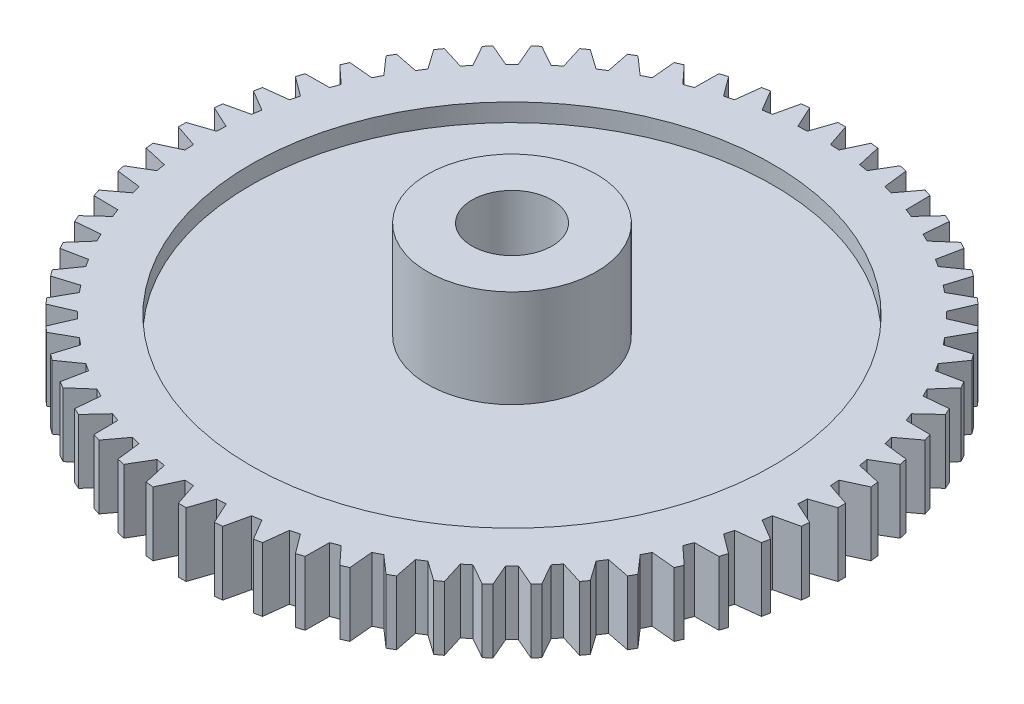
from build123d import *

# Parameters (mm, degrees)
SKETCH1_R           = 30.48
SKETCH1_R_2         = 8.382
BOSS_EXTRUDE1_DEPTH = 6.35
SKETCH1_3_R         = 8.382
SKETCH1_3_R_2       = 3.96875
BOSS_EXTRUDE2_DEPTH = 14.2621
SKETCH1_4_R         = 25.908
SKETCH1_4_R_2       = 8.382
CUT_EXTRUDE1_DEPTH  = 1.778
CUT_EXTRUDE3_START  = 4.572
SKETCH1_8_R         = 25.908
SKETCH1_8_R_2       = 8.382
CUT_EXTRUDE3_DEPTH  = 1.778
BOSS_EXTRUDE3_DEPTH = 6.35
CIRPATTERN1_COUNT   = 60


with BuildPart() as part:
    # Sketch1 → Boss-Extrude1 (new body)
    with BuildSketch(Plane(origin=(0, 0, 0), x_dir=(1, 0, 0), z_dir=(0, 1, 0))):
        Circle(SKETCH1_R)
        Circle(SKETCH1_R_2, mode=Mode.SUBTRACT)
    extrude(amount=BOSS_EXTRUDE1_DEPTH)

    # Sketch1<3> → Boss-Extrude2 (add)
    with BuildSketch(Plane(origin=(0, 0, 0), x_dir=(1, 0, 0), z_dir=(0, 1, 0))):
        Circle(SKETCH1_3_R)
        Circle(SKETCH1_3_R_2, mode=Mode.SUBTRACT)
    extrude(amount=BOSS_EXTRUDE2_DEPTH)

    # Sketch1<4> → Cut-Extrude1 (cut)
    with BuildSketch(Plane(origin=(0, 0, 0), x_dir=(1, 0, 0), z_dir=(0, 1, 0))):
        Circle(SKETCH1_4_R)
        Circle(SKETCH1_4_R_2, mode=Mode.SUBTRACT)
    extrude(amount=CUT_EXTRUDE1_DEPTH, mode=Mode.SUBTRACT)

    # Sketch1<8> → Cut-Extrude3 (cut)
    with BuildSketch(Plane(origin=(0, 0, 0), x_dir=(1, 0, 0), z_dir=(0, 1, 0)).offset(CUT_EXTRUDE3_START)):
        Circle(SKETCH1_8_R)
        Circle(SKETCH1_8_R_2, mode=Mode.SUBTRACT)
    extrude(amount=CUT_EXTRUDE3_DEPTH, mode=Mode.SUBTRACT)

    # Sketch2 → Boss-Extrude3 (add)
    with BuildSketch(Plane(origin=(0, 6.35, 0), x_dir=(1, 0, 0), z_dir=(0, 1, 0))):
        with BuildLine():
            Line((0.381, 32.7279), (-0.381, 32.7279))
            Line((-0.381, 32.7279), (-1.225912919, 30.23540689))
            ThreePointArc((-1.225912919, 30.23540689), (0, 30.260249376), (1.225912919, 30.23540689))
            Line((1.225912919, 30.23540689), (0.381, 32.7279))
        make_face()
    boss_extrude3 = extrude(amount=-BOSS_EXTRUDE3_DEPTH)

    # CirPattern1: Boss-Extrude3 ×60 about axis
    cirpattern1_axis = Axis((0, 6.35, 0), (0, -1, 0))
    for i in range(1, CIRPATTERN1_COUNT):
        add(boss_extrude3.rotate(cirpattern1_axis, i * 360 / CIRPATTERN1_COUNT))


solid = part.part
